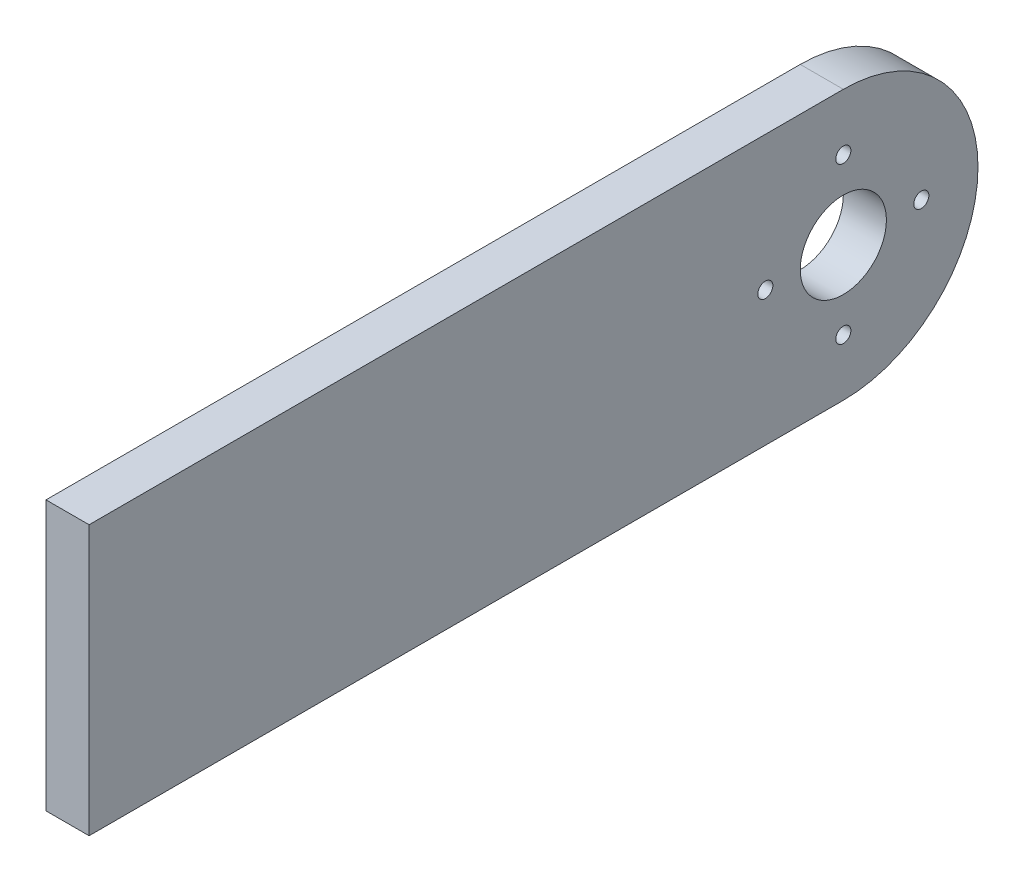
from build123d import *

# Parameters (mm, degrees)
SKETCH1_R           = 4
SKETCH1_R_2         = 0.7
BOSS_EXTRUDE1_DEPTH = 4


with BuildPart() as part:
    # Sketch1 → Boss-Extrude1 (new body)
    with BuildSketch(Plane(origin=(0, 0, 0), x_dir=(0, 0, -1), z_dir=(1, 0, 0))):
        with BuildLine():
            Line((-70, 12.5), (-70, -12.5))
            Line((-70, -12.5), (0, -12.5))
            ThreePointArc((0, -12.5), (12.5, 0), (0, 12.5))
            Line((0, 12.5), (-70, 12.5))
        make_face()
        Circle(SKETCH1_R, mode=Mode.SUBTRACT)
        with Locations((-7.24, 0)):
            Circle(SKETCH1_R_2, mode=Mode.SUBTRACT)
        with Locations((0, 7.24)):
            Circle(SKETCH1_R_2, mode=Mode.SUBTRACT)
        with Locations((7.24, 0)):
            Circle(SKETCH1_R_2, mode=Mode.SUBTRACT)
        with Locations((0, -7.24)):
            Circle(SKETCH1_R_2, mode=Mode.SUBTRACT)
    extrude(amount=BOSS_EXTRUDE1_DEPTH)


solid = part.part
